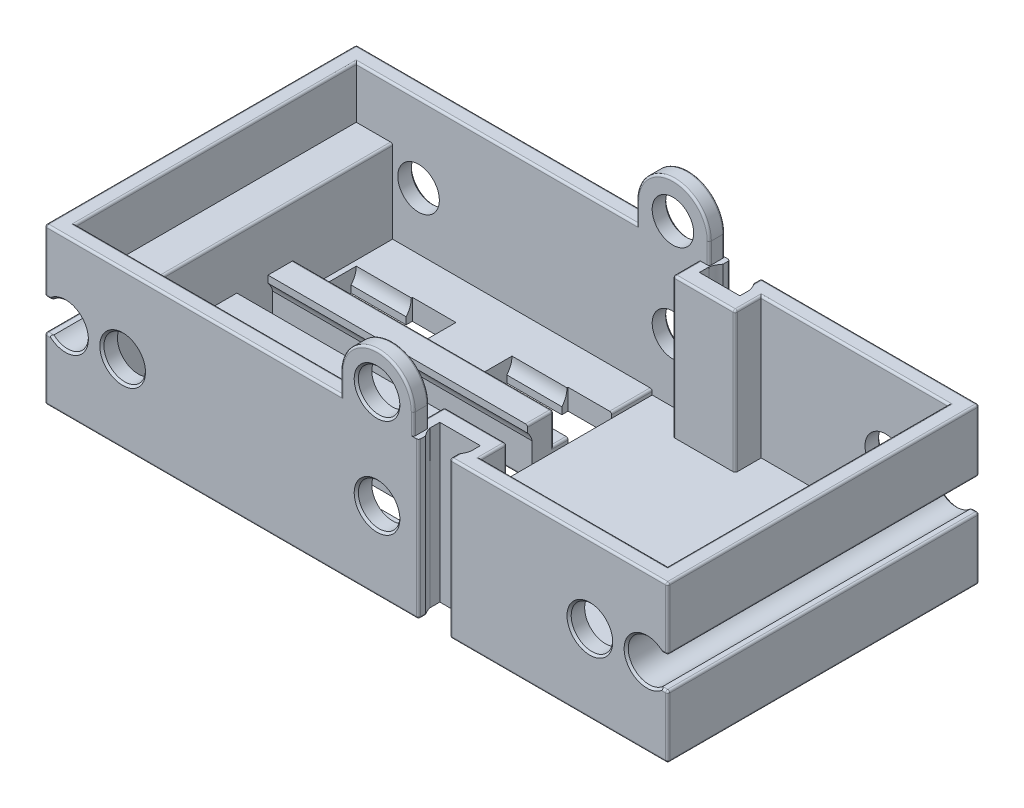
from build123d import *

# Parameters (mm, degrees)
SKETCH_1_W                  = 60
SKETCH_1_H                  = 30
EXTRUDE_1_DEPTH             = 15
CUT_EXTRUDE_1_DEPTH         = 5
CUT_EXTRUDE_2_DEPTH         = 8.5
CUT_EXTRUDE_3_REACH         = 38.742
SKETCH_5_R                  = 2
CUT_EXTRUDE_4_DEPTH         = 46
SKETCH_6_W                  = 2
SKETCH_6_H                  = 27
CUT_EXTRUDE_5_DEPTH         = 5
SKETCH_7_W                  = 2
SKETCH_7_H                  = 1.5
EXTRUDE_2_DEPTH             = 2.5
SKETCH_8_W                  = 25
SKETCH_8_H                  = 27
EXTRUDE_3_DEPTH             = 0.5
CUT_EXTRUDE_6_REACH         = 37.972
SKETCH_9_W                  = 4.2
SKETCH_9_H                  = 4.2
CUT_EXTRUDE_7_DEPTH         = 5.3
PATTERN_LINEAR_1_COUNT      = 2
PATTERN_LINEAR_1_PITCH      = 15
PATTERN_LINEAR_1_COUNT_DIR2 = 2
PATTERN_LINEAR_1_PITCH_DIR2 = 15
SKETCH_13_W                 = 8
SKETCH_13_H                 = 5
EXTRUDE_4_DEPTH             = 25
CUT_EXTRUDE_8_DEPTH         = 25
EXTRUDE_5_DEPTH             = 1.5
CUT_EXTRUDE_9_REACH         = 49.12
SKETCH_16_R                 = 2
FILLET_1_R                  = 0.2
FILLET_2_R                  = 0.2
FILLET_3_R                  = 0.2
CHAMFER_1_SIZE              = 0.2
FILLET_4_R                  = 0.2


with BuildPart() as part:
    # 草图1 → 凸台-拉伸1 (new body)
    with BuildSketch(Plane(origin=(0, 0, 0), x_dir=(1, 0, 0), z_dir=(0, 1, 0))):
        Rectangle(SKETCH_1_W, SKETCH_1_H)
    extrude(amount=EXTRUDE_1_DEPTH)

    # 草图2 → 切除-拉伸1 (cut)
    with BuildSketch(Plane(origin=(0, 15, 0), x_dir=(1, 0, 0), z_dir=(0, 1, 0))):
        Polygon((28.5, 13.5), (28.5, -13.5), (10.5, -13.5), (10.5, -11), (4.5, -11), (4.5, -13.5), (-28.5, -13.5), (-28.5, 13.5), (4.5, 13.5), (4.5, 11), (10.5, 11), (10.5, 13.5), align=None)
    extrude(amount=-CUT_EXTRUDE_1_DEPTH, mode=Mode.SUBTRACT)

    # 草图3 → 切除-拉伸2 (cut)
    with BuildSketch(Plane(origin=(0, 10, 0), x_dir=(1, 0, 0), z_dir=(0, 1, 0))):
        Polygon((-25, 13.5), (-25, -13.5), (4.5, -13.5), (4.5, -11), (10.5, -11), (10.5, -13.5), (25, -13.5), (25, 13.5), (10.5, 13.5), (10.5, 11), (4.5, 11), (4.5, 13.5), align=None)
    extrude(amount=-CUT_EXTRUDE_2_DEPTH, mode=Mode.SUBTRACT)

    # 草图4 → 切除-拉伸3 (cut, up to next)
    with BuildSketch(Plane(origin=(0, 15, 0), x_dir=(1, 0, 0), z_dir=(0, 1, 0)), mode=Mode.PRIVATE) as cut_extrude_3_sk1:
        with BuildLine():
            Line((9, -15), (6, -15))
            Line((6, -15), (6, -14.322875656))
            ThreePointArc((6, -14.322875656), (5.719957697, -13.911838473), (5.55, -13.444409721))
            Line((5.55, -13.444409721), (5.55, -12.5))
            Line((5.55, -12.5), (9.45, -12.5))
            Line((9.45, -12.5), (9.45, -13.444409721))
            ThreePointArc((9.45, -13.444409721), (9.280042303, -13.911838473), (9, -14.322875656))
            Line((9, -14.322875656), (9, -15))
        make_face()
    cut_extrude_3_tool1 = extrude(cut_extrude_3_sk1.sketch, amount=-CUT_EXTRUDE_3_REACH, mode=Mode.PRIVATE) & part.part
    cut_extrude_3 = cut_extrude_3_tool1.solids().sort_by_distance((7.5, 15, 13.675873))[0]
    add(cut_extrude_3, mode=Mode.SUBTRACT)

    # 镜向1: 切除-拉伸3 across plane
    add(cut_extrude_3.mirror(Plane.XY), mode=Mode.SUBTRACT)

    # 草图5 → 切除-拉伸4 (cut, through all)
    with BuildSketch(Plane.XY.offset(15)):
        with Locations((-22.5, 7.5)):
            Circle(SKETCH_5_R)
        with BuildLine():
            Line((-30, 6), (-30, 9))
            Line((-30, 9), (-29.322875656, 9))
            ThreePointArc((-29.322875656, 9), (-26, 7.5), (-29.322875656, 6))
            Line((-29.322875656, 6), (-30, 6))
        make_face()
    cut_extrude_4 = extrude(amount=-CUT_EXTRUDE_4_DEPTH, mode=Mode.SUBTRACT)

    # 镜向2: 切除-拉伸4 across plane
    add(cut_extrude_4.mirror(Plane(origin=(0, 0, 0), x_dir=(0, 0, 1), z_dir=(1, 0, 0))), mode=Mode.SUBTRACT)

    # 草图6 → 切除-拉伸5 (cut)
    with BuildSketch(Plane.XZ):
        with Locations((-27.5, 0)):
            Rectangle(SKETCH_6_W, SKETCH_6_H)
    cut_extrude_5 = extrude(amount=-CUT_EXTRUDE_5_DEPTH, mode=Mode.SUBTRACT)

    # 草图7 → 凸台-拉伸2 (add)
    with BuildSketch(Plane.XZ.offset(-5)):
        with Locations((-27.5, 2.75)):
            Rectangle(SKETCH_7_W, SKETCH_7_H)
        with Locations((-27.5, -2.75)):
            Rectangle(SKETCH_7_W, SKETCH_7_H)
    extrude_2 = extrude(amount=EXTRUDE_2_DEPTH)

    # 镜向3: 切除-拉伸5, 凸台-拉伸2 across plane
    add(cut_extrude_5.mirror(Plane(origin=(0, 0, 0), x_dir=(0, 0, 1), z_dir=(1, 0, 0))), mode=Mode.SUBTRACT)
    add(extrude_2.mirror(Plane(origin=(0, 0, 0), x_dir=(0, 0, 1), z_dir=(1, 0, 0))))

    # 草图8 → 凸台-拉伸3 (add)
    with BuildSketch(Plane(origin=(0, 1.5, 0), x_dir=(1, 0, 0), z_dir=(0, 1, 0))):
        with Locations((-12.5, 0)):
            Rectangle(SKETCH_8_W, SKETCH_8_H)
    extrude(amount=EXTRUDE_3_DEPTH)

    # 草图9 → 切除-拉伸6 (cut, up to next)
    with BuildSketch(Plane(origin=(0, 2, 0), x_dir=(1, 0, 0), z_dir=(0, 1, 0)), mode=Mode.PRIVATE) as cut_extrude_6_sk1:
        with Locations((-2.1, 7.5)):
            Rectangle(SKETCH_9_W, SKETCH_9_H)
    cut_extrude_6_tool1 = extrude(cut_extrude_6_sk1.sketch, amount=-CUT_EXTRUDE_6_REACH, mode=Mode.PRIVATE) & part.part
    cut_extrude_6 = cut_extrude_6_tool1.solids().sort_by_distance((-2.1, 2, -7.5))[0]
    add(cut_extrude_6, mode=Mode.SUBTRACT)

    # 草图10 → 切除-拉伸7 (cut)
    with BuildSketch(Plane(origin=(-4.2, 0, 0), x_dir=(0, 0, -1), z_dir=(1, 0, 0))):
        with BuildLine():
            Line((9, 0), (6, 0))
            Line((6, 0), (6, 0.677124344))
            ThreePointArc((6, 0.677124344), (7.5, 4), (9, 0.677124344))
            Line((9, 0.677124344), (9, 0))
        make_face()
    cut_extrude_7 = extrude(amount=-CUT_EXTRUDE_7_DEPTH, mode=Mode.SUBTRACT)

    # 阵列(线性)1: 切除-拉伸6, Cut-Extrude 7 2 × 2
    with Locations(*[(-i * PATTERN_LINEAR_1_PITCH, 0, j * PATTERN_LINEAR_1_PITCH_DIR2) for i in range(PATTERN_LINEAR_1_COUNT) for j in range(PATTERN_LINEAR_1_COUNT_DIR2) if (i, j) != (0, 0)]):
        add(cut_extrude_6, mode=Mode.SUBTRACT)
        add(cut_extrude_7, mode=Mode.SUBTRACT)

    # 草图13 → 凸台-拉伸4 (add)
    with BuildSketch(Plane(origin=(-25, 0, 0), x_dir=(0, 0, -1), z_dir=(1, 0, 0))):
        with Locations((0, 2.5)):
            Rectangle(SKETCH_13_W, SKETCH_13_H)
    extrude(amount=EXTRUDE_4_DEPTH)

    # 草图14 → 切除-拉伸8 (cut)
    with BuildSketch(Plane(origin=(0, 0, 0), x_dir=(0, 0, -1), z_dir=(1, 0, 0))):
        with BuildLine():
            Line((1.5, 5), (-1.5, 5))
            Line((-1.5, 5), (-1.5, 4.322875656))
            ThreePointArc((-1.5, 4.322875656), (-1.780042303, 3.911838473), (-1.95, 3.444409721))
            Line((-1.95, 3.444409721), (-1.95, 0))
            Line((-1.95, 0), (1.95, 0))
            Line((1.95, 0), (1.95, 3.444409721))
            ThreePointArc((1.95, 3.444409721), (1.780042303, 3.911838473), (1.5, 4.322875656))
            Line((1.5, 4.322875656), (1.5, 5))
        make_face()
    extrude(amount=-CUT_EXTRUDE_8_DEPTH, mode=Mode.SUBTRACT)

    # 草图15 → 凸台-拉伸5 (add)
    with BuildSketch(Plane(origin=(0, 0, -15), x_dir=(-1, 0, 0), z_dir=(0, 0, -1))):
        with BuildLine():
            Line((-5.5, 17), (-5.5, 15))
            Line((-5.5, 15), (1.5, 15))
            Line((1.5, 15), (1.5, 17))
            ThreePointArc((1.5, 17), (-2, 20.5), (-5.5, 17))
        make_face()
    extrude_5 = extrude(amount=-EXTRUDE_5_DEPTH)

    # 草图16 → 切除-拉伸9 (cut, up to next)
    with BuildSketch(Plane(origin=(0, 0, -15), x_dir=(-1, 0, 0), z_dir=(0, 0, -1)), mode=Mode.PRIVATE) as cut_extrude_9_sk1:
        with Locations((-2, 17)):
            Circle(SKETCH_16_R)
    cut_extrude_9_tool1 = extrude(cut_extrude_9_sk1.sketch, amount=-CUT_EXTRUDE_9_REACH, mode=Mode.PRIVATE) & part.part
    # 草图16 → 切除-拉伸9 (cut, up to next)
    with BuildSketch(Plane(origin=(0, 0, -15), x_dir=(-1, 0, 0), z_dir=(0, 0, -1)), mode=Mode.PRIVATE) as cut_extrude_9_sk2:
        with Locations((-2, 7.5)):
            Circle(SKETCH_16_R)
    cut_extrude_9_tool2 = extrude(cut_extrude_9_sk2.sketch, amount=-CUT_EXTRUDE_9_REACH, mode=Mode.PRIVATE) & part.part
    cut_extrude_9_1 = cut_extrude_9_tool1.solids().sort_by_distance((2, 17, -15))[0]
    add(cut_extrude_9_1, mode=Mode.SUBTRACT)
    cut_extrude_9_2 = cut_extrude_9_tool2.solids().sort_by_distance((2, 7.5, -15))[0]
    add(cut_extrude_9_2, mode=Mode.SUBTRACT)
    cut_extrude_9 = cut_extrude_9_1 + cut_extrude_9_2  # 切除-拉伸9 as one shape, for the pattern or mirror that repeats it

    # 镜向4: 凸台-拉伸5, 切除-拉伸9 across plane
    add(extrude_5.mirror(Plane.XY))
    add(cut_extrude_9.mirror(Plane.XY), mode=Mode.SUBTRACT)

    # 圆角1
    fillet_1_edges = [part.edges().sort_by_distance(p)[0] for p in [
        (-1.5, 16, -15),
        (-1.5, 16, -13.5),
        (5.5, 16, -15),
        (5.5, 16, -13.5),
        (-1.5, 16, 15),
        (-1.5, 16, 13.5),
        (5.5, 16, 15),
        (5.5, 16, 13.5),
        (-30, 0, 0),
        (-12, 0, 15),
        (-12, 0, -15),
        (19.5, 0, -15),
        (19.5, 0, 15),
        (30, 0, 0),
        (30, 3, -15),
        (30, 12, -15),
        (30, 3, 15),
        (30, 12, 15),
        (-30, 3, -15),
        (-30, 12, -15),
        (-30, 3, 15),
        (-30, 12, 15),
        (2, 20.5, -15),
        (2, 20.5, -13.5),
        (2, 20.5, 15),
        (2, 20.5, 13.5),
        (4.5, 15, 12.25),
        (7.5, 15, 11),
        (10.5, 15, 12.25),
        (19.5, 15, 13.5),
        (19.5, 15, 15),
        (28.5, 15, 0),
        (30, 15, 0),
        (19.5, 15, -15),
        (19.5, 15, -13.5),
        (10.5, 15, -12.25),
        (7.5, 15, -11),
        (4.5, 15, -12.25),
        (-15, 15, 13.5),
        (-15.75, 15, 15),
        (-28.5, 15, 0),
        (-15, 15, -13.5),
        (-15.75, 15, -15),
        (-30, 15, 0),
    ]]
    fillet(fillet_1_edges, radius=FILLET_1_R)

    # 圆角2
    # the kernel refuses this fillet: 0.2 mm, written as the material it takes off along each edge
    with BuildSketch(Plane(origin=(10.3, 14.8, 11.2), x_dir=(1, 0, 0), z_dir=(0, 0, -1))) as fillet_2_piece_1_section:
        Polygon((0, 0), (FILLET_2_R, 0), (FILLET_2_R, -FILLET_2_R), (0, -FILLET_2_R), align=None)
    fillet_2_piece_1 = extrude(amount=FILLET_2_R, mode=Mode.PRIVATE)
    fillet_2_piece_1 = fillet_2_piece_1 - Plane(origin=(10.3, 14.8, 11.2), x_dir=(-0.7071067811865475, -0.7071067811865475, 1.0048591735576168e-15), z_dir=(0, 0, -1)) * Sphere(FILLET_2_R, mode=Mode.PRIVATE)
    add(fillet_2_piece_1, mode=Mode.SUBTRACT)
    with BuildSketch(Plane(origin=(4.7, 14.8, 11.2), x_dir=(-1, 0, 0), z_dir=(0, 0, -1))) as fillet_2_piece_2_section:
        Polygon((0, 0), (FILLET_2_R, 0), (FILLET_2_R, FILLET_2_R), (0, FILLET_2_R), align=None)
    fillet_2_piece_2 = extrude(amount=FILLET_2_R, mode=Mode.PRIVATE)
    fillet_2_piece_2 = fillet_2_piece_2 - Plane(origin=(4.7, 14.8, 11.2), x_dir=(0.7071067811865475, -0.7071067811865475, 0), z_dir=(0, 0, -1)) * Sphere(FILLET_2_R, mode=Mode.PRIVATE)
    add(fillet_2_piece_2, mode=Mode.SUBTRACT)
    with BuildSketch(Plane(origin=(10.3, 14.8, -11.2), x_dir=(1, 0, 0), z_dir=(0, 0, 1))) as fillet_2_piece_3_section:
        Polygon((0, 0), (FILLET_2_R, 0), (FILLET_2_R, FILLET_2_R), (0, FILLET_2_R), align=None)
    fillet_2_piece_3 = extrude(amount=FILLET_2_R, mode=Mode.PRIVATE)
    fillet_2_piece_3 = fillet_2_piece_3 - Plane(origin=(10.3, 14.8, -11.2), x_dir=(-0.7071067811865475, -0.7071067811865475, -1.0048591735576152e-15), z_dir=(0, 0, 1)) * Sphere(FILLET_2_R, mode=Mode.PRIVATE)
    add(fillet_2_piece_3, mode=Mode.SUBTRACT)
    with BuildSketch(Plane(origin=(4.7, 14.8, -11.2), x_dir=(0, 0, 1), z_dir=(-1, 0, 0))) as fillet_2_piece_4_section:
        Polygon((0, 0), (FILLET_2_R, 0), (FILLET_2_R, FILLET_2_R), (0, FILLET_2_R), align=None)
    fillet_2_piece_4 = extrude(amount=FILLET_2_R, mode=Mode.PRIVATE)
    fillet_2_piece_4 = fillet_2_piece_4 - Plane(origin=(4.7, 14.8, -11.2), x_dir=(0, -0.7071067811865475, -0.7071067811865475), z_dir=(-1, 0, 0)) * Sphere(FILLET_2_R, mode=Mode.PRIVATE)
    add(fillet_2_piece_4, mode=Mode.SUBTRACT)
    with BuildSketch(Plane(origin=(0, 0, 1.95), x_dir=(0, 1, 0), z_dir=(0, 0, -1))) as fillet_2_piece_5:
        with BuildLine():
            CenterArc((FILLET_2_R, FILLET_2_R), FILLET_2_R, 180, 90)
            Line((0, FILLET_2_R), (0, 0))
            Line((0, 0), (FILLET_2_R, 0))
        make_face()
    extrude(amount=3.9, mode=Mode.SUBTRACT)
    with BuildSketch(Plane(origin=(0, 0, -1.95), x_dir=(0, 1, 0), z_dir=(-1, 0, 0))) as fillet_2_piece_6:
        with BuildLine():
            CenterArc((FILLET_2_R, FILLET_2_R), FILLET_2_R, 180, 90)
            Line((0, FILLET_2_R), (0, 0))
            Line((0, 0), (FILLET_2_R, 0))
        make_face()
    extrude(amount=25, mode=Mode.SUBTRACT)
    with BuildSketch(Plane(origin=(-25, 0, 1.95), x_dir=(0, 1, 0), z_dir=(0, 0, -1))) as fillet_2_piece_7:
        with BuildLine():
            CenterArc((FILLET_2_R, -FILLET_2_R), FILLET_2_R, 90, 90)
            Line((0, -FILLET_2_R), (0, 0))
            Line((0, 0), (FILLET_2_R, 0))
        make_face()
    extrude(amount=3.9, mode=Mode.SUBTRACT)
    with BuildSketch(Plane(origin=(0, 0, 1.95), x_dir=(0, 1, 0), z_dir=(-1, 0, 0))) as fillet_2_piece_8:
        with BuildLine():
            CenterArc((FILLET_2_R, -FILLET_2_R), FILLET_2_R, 90, 90)
            Line((0, -FILLET_2_R), (0, 0))
            Line((0, 0), (FILLET_2_R, 0))
        make_face()
    extrude(amount=25, mode=Mode.SUBTRACT)
    with BuildSketch(Plane(origin=(-26.5, 0, -13.5), x_dir=(0, 0, -1), z_dir=(-1, 0, 0)), Plane(origin=(-28.5, 0, 13.5), x_dir=(0, 0, 1), z_dir=(1, 0, 0))) as fillet_2_piece_9:
        with BuildLine():
            CenterArc((FILLET_2_R, -FILLET_2_R), FILLET_2_R, 90, 90)
            Line((0, -FILLET_2_R), (0, 0))
            Line((0, 0), (FILLET_2_R, 0))
        make_face()
    extrude(amount=2, mode=Mode.SUBTRACT)
    with BuildSketch(Plane(origin=(-28.5, 0, -13.5), x_dir=(-1, 0, 0), z_dir=(0, 0, 1)), Plane(origin=(-26.5, 0, 13.5), x_dir=(1, 0, 0), z_dir=(0, 0, -1)), Plane(origin=(25, 10, 13.5), x_dir=(0, -1, 0), z_dir=(0, 0, -1))) as fillet_2_piece_10:
        with BuildLine():
            CenterArc((FILLET_2_R, -FILLET_2_R), FILLET_2_R, 90, 90)
            Line((0, -FILLET_2_R), (0, 0))
            Line((0, 0), (FILLET_2_R, 0))
        make_face()
    extrude(amount=27, mode=Mode.SUBTRACT)
    with BuildSketch(Plane(origin=(26.5, 0, -13.5), x_dir=(0, 0, -1), z_dir=(1, 0, 0)), Plane(origin=(28.5, 0, 13.5), x_dir=(0, 0, 1), z_dir=(-1, 0, 0))) as fillet_2_piece_11:
        with BuildLine():
            CenterArc((FILLET_2_R, FILLET_2_R), FILLET_2_R, 180, 90)
            Line((0, FILLET_2_R), (0, 0))
            Line((0, 0), (FILLET_2_R, 0))
        make_face()
    extrude(amount=2, mode=Mode.SUBTRACT)
    with BuildSketch(Plane(origin=(26.5, 0, 13.5), x_dir=(-1, 0, 0), z_dir=(0, 0, -1)), Plane(origin=(28.5, 0, -13.5), x_dir=(1, 0, 0), z_dir=(0, 0, 1)), Plane(origin=(-25, 10, -13.5), x_dir=(-1, 0, 0), z_dir=(0, 0, 1))) as fillet_2_piece_12:
        with BuildLine():
            CenterArc((FILLET_2_R, FILLET_2_R), FILLET_2_R, 180, 90)
            Line((0, FILLET_2_R), (0, 0))
            Line((0, 0), (FILLET_2_R, 0))
        make_face()
    extrude(amount=27, mode=Mode.SUBTRACT)
    with BuildSketch(Plane(origin=(10.5, 1.5, 11), x_dir=(-1, 0, 0), z_dir=(0, 1, 0))) as fillet_2_piece_13:
        with BuildLine():
            CenterArc((FILLET_2_R, FILLET_2_R), FILLET_2_R, 180, 90)
            Line((0, FILLET_2_R), (0, 0))
            Line((0, 0), (FILLET_2_R, 0))
        make_face()
    extrude(amount=13.3, mode=Mode.SUBTRACT)
    with BuildSketch(Plane(origin=(4.5, 1.5, 11), x_dir=(1, 0, 0), z_dir=(0, 1, 0)), Plane(origin=(10.5, 1.5, -11), x_dir=(-1, 0, 0), z_dir=(0, 1, 0)), Plane(origin=(4.5, 1.5, -11), x_dir=(0, 0, -1), z_dir=(0, 1, 0))) as fillet_2_piece_14:
        with BuildLine():
            CenterArc((FILLET_2_R, -FILLET_2_R), FILLET_2_R, 90, 90)
            Line((0, -FILLET_2_R), (0, 0))
            Line((0, 0), (FILLET_2_R, 0))
        make_face()
    extrude(amount=13.3, mode=Mode.SUBTRACT)
    with BuildSketch(Plane(origin=(0.5, 0, 1.95), x_dir=(0, 1, 0), z_dir=(-1, 0, 0))) as fillet_2_piece_15a_section:
        with BuildLine():
            CenterArc((FILLET_2_R, -FILLET_2_R), FILLET_2_R, 90, 90)
            Line((0, -FILLET_2_R), (0, 0))
            Line((0, 0), (FILLET_2_R, 0))
        make_face()
    fillet_2_piece_15a = extrude(amount=25.5, mode=Mode.PRIVATE)
    fillet_2_piece_15a = split(fillet_2_piece_15a, bisect_by=Plane(origin=(0, 0.045279023, 1.995279023), z_dir=(1, 0, 0)), keep=Keep.TOP, mode=Mode.PRIVATE)
    with BuildSketch(Plane(origin=(0, 0, 2.45), x_dir=(0, 1, 0), z_dir=(0, 0, -1))) as fillet_2_piece_15b_section:
        with BuildLine():
            CenterArc((FILLET_2_R, FILLET_2_R), FILLET_2_R, 180, 90)
            Line((0, FILLET_2_R), (0, 0))
            Line((0, 0), (FILLET_2_R, 0))
        make_face()
    fillet_2_piece_15b = extrude(amount=4.4, mode=Mode.PRIVATE)
    fillet_2_piece_15b = split(fillet_2_piece_15b, bisect_by=Plane(origin=(0.045279023, 0.045279023, 1.95), z_dir=(0, 0, 1)), keep=Keep.TOP, mode=Mode.PRIVATE)
    fillet_2_piece_15 = fillet_2_piece_15a & fillet_2_piece_15b
    add(fillet_2_piece_15, mode=Mode.SUBTRACT)
    with BuildSketch(Plane(origin=(0.5, 0, -1.95), x_dir=(0, 1, 0), z_dir=(-1, 0, 0))) as fillet_2_piece_16a_section:
        with BuildLine():
            CenterArc((FILLET_2_R, FILLET_2_R), FILLET_2_R, 180, 90)
            Line((0, FILLET_2_R), (0, 0))
            Line((0, 0), (FILLET_2_R, 0))
        make_face()
    fillet_2_piece_16a = extrude(amount=25.5, mode=Mode.PRIVATE)
    fillet_2_piece_16a = split(fillet_2_piece_16a, bisect_by=Plane(origin=(0, 0.045279023, -1.995279023), z_dir=(1, 0, 0)), keep=Keep.TOP, mode=Mode.PRIVATE)
    with BuildSketch(Plane(origin=(0, 0, 1.95), x_dir=(0, 1, 0), z_dir=(0, 0, -1))) as fillet_2_piece_16b_section:
        with BuildLine():
            CenterArc((FILLET_2_R, FILLET_2_R), FILLET_2_R, 180, 90)
            Line((0, FILLET_2_R), (0, 0))
            Line((0, 0), (FILLET_2_R, 0))
        make_face()
    fillet_2_piece_16b = extrude(amount=4.4, mode=Mode.PRIVATE)
    fillet_2_piece_16b = split(fillet_2_piece_16b, bisect_by=Plane(origin=(0.045279023, 0.045279023, -1.95), z_dir=(0, 0, -1)), keep=Keep.TOP, mode=Mode.PRIVATE)
    fillet_2_piece_16 = fillet_2_piece_16a & fillet_2_piece_16b
    add(fillet_2_piece_16, mode=Mode.SUBTRACT)
    with BuildSketch(Plane(origin=(-25, 0, 1.95), x_dir=(0, 1, 0), z_dir=(0, 0, -1))) as fillet_2_piece_17a_section:
        with BuildLine():
            CenterArc((FILLET_2_R, -FILLET_2_R), FILLET_2_R, 90, 90)
            Line((0, -FILLET_2_R), (0, 0))
            Line((0, 0), (FILLET_2_R, 0))
        make_face()
    fillet_2_piece_17a = extrude(amount=4.4, mode=Mode.PRIVATE)
    fillet_2_piece_17a = split(fillet_2_piece_17a, bisect_by=Plane(origin=(-25.045279023, 0.045279023, -1.95), z_dir=(0, 0, -1)), keep=Keep.TOP, mode=Mode.PRIVATE)
    with BuildSketch(Plane(origin=(0, 0, -1.95), x_dir=(0, 1, 0), z_dir=(-1, 0, 0))) as fillet_2_piece_17b_section:
        with BuildLine():
            CenterArc((FILLET_2_R, FILLET_2_R), FILLET_2_R, 180, 90)
            Line((0, FILLET_2_R), (0, 0))
            Line((0, 0), (FILLET_2_R, 0))
        make_face()
    fillet_2_piece_17b = extrude(amount=25.5, mode=Mode.PRIVATE)
    fillet_2_piece_17b = split(fillet_2_piece_17b, bisect_by=Plane(origin=(-25, 0.045279023, -1.995279023), z_dir=(-1, 0, 0)), keep=Keep.TOP, mode=Mode.PRIVATE)
    fillet_2_piece_17 = fillet_2_piece_17a & fillet_2_piece_17b
    add(fillet_2_piece_17, mode=Mode.SUBTRACT)
    with BuildSketch(Plane(origin=(-25, 0, 2.45), x_dir=(0, 1, 0), z_dir=(0, 0, -1))) as fillet_2_piece_18a_section:
        with BuildLine():
            CenterArc((FILLET_2_R, -FILLET_2_R), FILLET_2_R, 90, 90)
            Line((0, -FILLET_2_R), (0, 0))
            Line((0, 0), (FILLET_2_R, 0))
        make_face()
    fillet_2_piece_18a = extrude(amount=4.4, mode=Mode.PRIVATE)
    fillet_2_piece_18a = split(fillet_2_piece_18a, bisect_by=Plane(origin=(-25.045279023, 0.045279023, 1.95), z_dir=(0, 0, 1)), keep=Keep.TOP, mode=Mode.PRIVATE)
    with BuildSketch(Plane(origin=(0, 0, 1.95), x_dir=(0, 1, 0), z_dir=(-1, 0, 0))) as fillet_2_piece_18b_section:
        with BuildLine():
            CenterArc((FILLET_2_R, -FILLET_2_R), FILLET_2_R, 90, 90)
            Line((0, -FILLET_2_R), (0, 0))
            Line((0, 0), (FILLET_2_R, 0))
        make_face()
    fillet_2_piece_18b = extrude(amount=25.5, mode=Mode.PRIVATE)
    fillet_2_piece_18b = split(fillet_2_piece_18b, bisect_by=Plane(origin=(-25, 0.045279023, 1.995279023), z_dir=(-1, 0, 0)), keep=Keep.TOP, mode=Mode.PRIVATE)
    fillet_2_piece_18 = fillet_2_piece_18a & fillet_2_piece_18b
    add(fillet_2_piece_18, mode=Mode.SUBTRACT)
    with BuildSketch(Plane(origin=(-26, 0, -13.5), x_dir=(0, 0, -1), z_dir=(-1, 0, 0))) as fillet_2_piece_19a_section:
        with BuildLine():
            CenterArc((FILLET_2_R, -FILLET_2_R), FILLET_2_R, 90, 90)
            Line((0, -FILLET_2_R), (0, 0))
            Line((0, 0), (FILLET_2_R, 0))
        make_face()
    fillet_2_piece_19a = extrude(amount=2.5, mode=Mode.PRIVATE)
    fillet_2_piece_19a = split(fillet_2_piece_19a, bisect_by=Plane(origin=(-26.5, 0.045279023, -13.545279023), z_dir=(1, 0, 0)), keep=Keep.TOP, mode=Mode.PRIVATE)
    with BuildSketch(Plane(origin=(-26.5, 0, 13.5), x_dir=(1, 0, 0), z_dir=(0, 0, -1))) as fillet_2_piece_19b_section:
        with BuildLine():
            CenterArc((FILLET_2_R, -FILLET_2_R), FILLET_2_R, 90, 90)
            Line((0, -FILLET_2_R), (0, 0))
            Line((0, 0), (FILLET_2_R, 0))
        make_face()
    fillet_2_piece_19b = extrude(amount=27.5, mode=Mode.PRIVATE)
    fillet_2_piece_19b = split(fillet_2_piece_19b, bisect_by=Plane(origin=(-26.454720977, 0.045279023, -13.5), z_dir=(0, 0, -1)), keep=Keep.TOP, mode=Mode.PRIVATE)
    fillet_2_piece_19 = fillet_2_piece_19a & fillet_2_piece_19b
    add(fillet_2_piece_19, mode=Mode.SUBTRACT)
    with BuildSketch(Plane(origin=(-28.5, 0, -14), x_dir=(-1, 0, 0), z_dir=(0, 0, 1))) as fillet_2_piece_20a_section:
        with BuildLine():
            CenterArc((FILLET_2_R, -FILLET_2_R), FILLET_2_R, 90, 90)
            Line((0, -FILLET_2_R), (0, 0))
            Line((0, 0), (FILLET_2_R, 0))
        make_face()
    fillet_2_piece_20a = extrude(amount=27.5, mode=Mode.PRIVATE)
    fillet_2_piece_20a = split(fillet_2_piece_20a, bisect_by=Plane(origin=(-28.545279023, 0.045279023, -13.5), z_dir=(0, 0, -1)), keep=Keep.TOP, mode=Mode.PRIVATE)
    with BuildSketch(Plane(origin=(-26.5, 0, -13.5), x_dir=(0, 0, -1), z_dir=(-1, 0, 0))) as fillet_2_piece_20b_section:
        with BuildLine():
            CenterArc((FILLET_2_R, -FILLET_2_R), FILLET_2_R, 90, 90)
            Line((0, -FILLET_2_R), (0, 0))
            Line((0, 0), (FILLET_2_R, 0))
        make_face()
    fillet_2_piece_20b = extrude(amount=2.5, mode=Mode.PRIVATE)
    fillet_2_piece_20b = split(fillet_2_piece_20b, bisect_by=Plane(origin=(-28.5, 0.045279023, -13.545279023), z_dir=(-1, 0, 0)), keep=Keep.TOP, mode=Mode.PRIVATE)
    fillet_2_piece_20 = fillet_2_piece_20a & fillet_2_piece_20b
    add(fillet_2_piece_20, mode=Mode.SUBTRACT)
    with BuildSketch(Plane(origin=(-28.5, 0, -13.5), x_dir=(-1, 0, 0), z_dir=(0, 0, 1))) as fillet_2_piece_21a_section:
        with BuildLine():
            CenterArc((FILLET_2_R, -FILLET_2_R), FILLET_2_R, 90, 90)
            Line((0, -FILLET_2_R), (0, 0))
            Line((0, 0), (FILLET_2_R, 0))
        make_face()
    fillet_2_piece_21a = extrude(amount=27.5, mode=Mode.PRIVATE)
    fillet_2_piece_21a = split(fillet_2_piece_21a, bisect_by=Plane(origin=(-28.545279023, 0.045279023, 13.5), z_dir=(0, 0, 1)), keep=Keep.TOP, mode=Mode.PRIVATE)
    with BuildSketch(Plane(origin=(-29, 0, 13.5), x_dir=(0, 0, 1), z_dir=(1, 0, 0))) as fillet_2_piece_21b_section:
        with BuildLine():
            CenterArc((FILLET_2_R, -FILLET_2_R), FILLET_2_R, 90, 90)
            Line((0, -FILLET_2_R), (0, 0))
            Line((0, 0), (FILLET_2_R, 0))
        make_face()
    fillet_2_piece_21b = extrude(amount=2.5, mode=Mode.PRIVATE)
    fillet_2_piece_21b = split(fillet_2_piece_21b, bisect_by=Plane(origin=(-28.5, 0.045279023, 13.545279023), z_dir=(-1, 0, 0)), keep=Keep.TOP, mode=Mode.PRIVATE)
    fillet_2_piece_21 = fillet_2_piece_21a & fillet_2_piece_21b
    add(fillet_2_piece_21, mode=Mode.SUBTRACT)
    with BuildSketch(Plane(origin=(-28.5, 0, 13.5), x_dir=(0, 0, 1), z_dir=(1, 0, 0))) as fillet_2_piece_22a_section:
        with BuildLine():
            CenterArc((FILLET_2_R, -FILLET_2_R), FILLET_2_R, 90, 90)
            Line((0, -FILLET_2_R), (0, 0))
            Line((0, 0), (FILLET_2_R, 0))
        make_face()
    fillet_2_piece_22a = extrude(amount=2.5, mode=Mode.PRIVATE)
    fillet_2_piece_22a = split(fillet_2_piece_22a, bisect_by=Plane(origin=(-26.5, 0.045279023, 13.545279023), z_dir=(1, 0, 0)), keep=Keep.TOP, mode=Mode.PRIVATE)
    with BuildSketch(Plane(origin=(-26.5, 0, 14), x_dir=(1, 0, 0), z_dir=(0, 0, -1))) as fillet_2_piece_22b_section:
        with BuildLine():
            CenterArc((FILLET_2_R, -FILLET_2_R), FILLET_2_R, 90, 90)
            Line((0, -FILLET_2_R), (0, 0))
            Line((0, 0), (FILLET_2_R, 0))
        make_face()
    fillet_2_piece_22b = extrude(amount=27.5, mode=Mode.PRIVATE)
    fillet_2_piece_22b = split(fillet_2_piece_22b, bisect_by=Plane(origin=(-26.454720977, 0.045279023, 13.5), z_dir=(0, 0, 1)), keep=Keep.TOP, mode=Mode.PRIVATE)
    fillet_2_piece_22 = fillet_2_piece_22a & fillet_2_piece_22b
    add(fillet_2_piece_22, mode=Mode.SUBTRACT)
    with BuildSketch(Plane(origin=(26.5, 0, 13.5), x_dir=(-1, 0, 0), z_dir=(0, 0, -1))) as fillet_2_piece_23a_section:
        with BuildLine():
            CenterArc((FILLET_2_R, FILLET_2_R), FILLET_2_R, 180, 90)
            Line((0, FILLET_2_R), (0, 0))
            Line((0, 0), (FILLET_2_R, 0))
        make_face()
    fillet_2_piece_23a = extrude(amount=27.5, mode=Mode.PRIVATE)
    fillet_2_piece_23a = split(fillet_2_piece_23a, bisect_by=Plane(origin=(26.454720977, 0.045279023, -13.5), z_dir=(0, 0, -1)), keep=Keep.TOP, mode=Mode.PRIVATE)
    with BuildSketch(Plane(origin=(26, 0, -13.5), x_dir=(0, 0, -1), z_dir=(1, 0, 0))) as fillet_2_piece_23b_section:
        with BuildLine():
            CenterArc((FILLET_2_R, FILLET_2_R), FILLET_2_R, 180, 90)
            Line((0, FILLET_2_R), (0, 0))
            Line((0, 0), (FILLET_2_R, 0))
        make_face()
    fillet_2_piece_23b = extrude(amount=2.5, mode=Mode.PRIVATE)
    fillet_2_piece_23b = split(fillet_2_piece_23b, bisect_by=Plane(origin=(26.5, 0.045279023, -13.545279023), z_dir=(-1, 0, 0)), keep=Keep.TOP, mode=Mode.PRIVATE)
    fillet_2_piece_23 = fillet_2_piece_23a & fillet_2_piece_23b
    add(fillet_2_piece_23, mode=Mode.SUBTRACT)
    with BuildSketch(Plane(origin=(28.5, 0, -14), x_dir=(1, 0, 0), z_dir=(0, 0, 1))) as fillet_2_piece_24a_section:
        with BuildLine():
            CenterArc((FILLET_2_R, FILLET_2_R), FILLET_2_R, 180, 90)
            Line((0, FILLET_2_R), (0, 0))
            Line((0, 0), (FILLET_2_R, 0))
        make_face()
    fillet_2_piece_24a = extrude(amount=27.5, mode=Mode.PRIVATE)
    fillet_2_piece_24a = split(fillet_2_piece_24a, bisect_by=Plane(origin=(28.545279023, 0.045279023, -13.5), z_dir=(0, 0, -1)), keep=Keep.TOP, mode=Mode.PRIVATE)
    with BuildSketch(Plane(origin=(26.5, 0, -13.5), x_dir=(0, 0, -1), z_dir=(1, 0, 0))) as fillet_2_piece_24b_section:
        with BuildLine():
            CenterArc((FILLET_2_R, FILLET_2_R), FILLET_2_R, 180, 90)
            Line((0, FILLET_2_R), (0, 0))
            Line((0, 0), (FILLET_2_R, 0))
        make_face()
    fillet_2_piece_24b = extrude(amount=2.5, mode=Mode.PRIVATE)
    fillet_2_piece_24b = split(fillet_2_piece_24b, bisect_by=Plane(origin=(28.5, 0.045279023, -13.545279023), z_dir=(1, 0, 0)), keep=Keep.TOP, mode=Mode.PRIVATE)
    fillet_2_piece_24 = fillet_2_piece_24a & fillet_2_piece_24b
    add(fillet_2_piece_24, mode=Mode.SUBTRACT)
    with BuildSketch(Plane(origin=(28.5, 0, 13.5), x_dir=(0, 0, 1), z_dir=(-1, 0, 0))) as fillet_2_piece_25a_section:
        with BuildLine():
            CenterArc((FILLET_2_R, FILLET_2_R), FILLET_2_R, 180, 90)
            Line((0, FILLET_2_R), (0, 0))
            Line((0, 0), (FILLET_2_R, 0))
        make_face()
    fillet_2_piece_25a = extrude(amount=2.5, mode=Mode.PRIVATE)
    fillet_2_piece_25a = split(fillet_2_piece_25a, bisect_by=Plane(origin=(26.5, 0.045279023, 13.545279023), z_dir=(-1, 0, 0)), keep=Keep.TOP, mode=Mode.PRIVATE)
    with BuildSketch(Plane(origin=(26.5, 0, 14), x_dir=(-1, 0, 0), z_dir=(0, 0, -1))) as fillet_2_piece_25b_section:
        with BuildLine():
            CenterArc((FILLET_2_R, FILLET_2_R), FILLET_2_R, 180, 90)
            Line((0, FILLET_2_R), (0, 0))
            Line((0, 0), (FILLET_2_R, 0))
        make_face()
    fillet_2_piece_25b = extrude(amount=27.5, mode=Mode.PRIVATE)
    fillet_2_piece_25b = split(fillet_2_piece_25b, bisect_by=Plane(origin=(26.454720977, 0.045279023, 13.5), z_dir=(0, 0, 1)), keep=Keep.TOP, mode=Mode.PRIVATE)
    fillet_2_piece_25 = fillet_2_piece_25a & fillet_2_piece_25b
    add(fillet_2_piece_25, mode=Mode.SUBTRACT)
    with BuildSketch(Plane(origin=(29, 0, 13.5), x_dir=(0, 0, 1), z_dir=(-1, 0, 0))) as fillet_2_piece_26a_section:
        with BuildLine():
            CenterArc((FILLET_2_R, FILLET_2_R), FILLET_2_R, 180, 90)
            Line((0, FILLET_2_R), (0, 0))
            Line((0, 0), (FILLET_2_R, 0))
        make_face()
    fillet_2_piece_26a = extrude(amount=2.5, mode=Mode.PRIVATE)
    fillet_2_piece_26a = split(fillet_2_piece_26a, bisect_by=Plane(origin=(28.5, 0.045279023, 13.545279023), z_dir=(1, 0, 0)), keep=Keep.TOP, mode=Mode.PRIVATE)
    with BuildSketch(Plane(origin=(28.5, 0, -13.5), x_dir=(1, 0, 0), z_dir=(0, 0, 1))) as fillet_2_piece_26b_section:
        with BuildLine():
            CenterArc((FILLET_2_R, FILLET_2_R), FILLET_2_R, 180, 90)
            Line((0, FILLET_2_R), (0, 0))
            Line((0, 0), (FILLET_2_R, 0))
        make_face()
    fillet_2_piece_26b = extrude(amount=27.5, mode=Mode.PRIVATE)
    fillet_2_piece_26b = split(fillet_2_piece_26b, bisect_by=Plane(origin=(28.545279023, 0.045279023, 13.5), z_dir=(0, 0, 1)), keep=Keep.TOP, mode=Mode.PRIVATE)
    fillet_2_piece_26 = fillet_2_piece_26a & fillet_2_piece_26b
    add(fillet_2_piece_26, mode=Mode.SUBTRACT)

    # 圆角3
    fillet_3_edges = [part.edges().sort_by_distance(p)[0] for p in [
        (0, 2, 11.55),
        (0, 2, -11.55),
        (0, 2, 4.7),
        (0, 2, -4.7),
        (-12.5, 5, -4),
        (-12.5, 5, 4),
        (0, 3.5, 4),
        (0, 3.5, -4),
        (0, 5, -2.75),
        (0, 5, 2.75),
    ]]
    fillet(fillet_3_edges, radius=FILLET_3_R)

    # 倒角1
    chamfer_1_edges = [part.edges().sort_by_distance(p)[0] for p in [
        (-24.5, 7.5, -15),
        (-24.5, 7.5, 15),
        (-26, 7.5, -15),
        (-26, 7.5, 15),
        (24.5, 7.5, 15),
        (24.5, 7.5, -15),
        (26, 7.5, 15),
        (26, 7.5, -15),
        (4, 17, -15),
        (4, 7.5, -15),
        (4, 17, 15),
        (4, 7.5, 15),
    ]]
    chamfer(chamfer_1_edges, length=CHAMFER_1_SIZE)

    # 圆角4
    fillet_4_edges = [part.edges().sort_by_distance(p)[0] for p in [
        (9, 0, -14.561437828),
        (9, 0.058578644, -14.941421356),
        (9, 15, -14.561437828),
        (9, 14.941421356, -14.941421356),
        (6, 0, -14.561437828),
        (6, 0.058578644, -14.941421356),
        (6, 0, 14.561437828),
        (6, 0.058578644, 14.941421356),
        (9, 0, 14.561437828),
        (9, 0.058578644, 14.941421356),
        (9, 15, 14.561437828),
        (9, 14.941421356, 14.941421356),
        (29.704673847, 9, -15),
        (29.941421356, 9, -14.941421356),
        (29.704673847, 9, 15),
        (29.941421356, 9, 14.941421356),
        (29.704673847, 6, -15),
        (29.941421356, 6, -14.941421356),
        (29.704673847, 6, 15),
        (29.941421356, 6, 14.941421356),
        (-29.704673847, 9, -15),
        (-29.941421356, 9, -14.941421356),
        (-29.704673847, 9, 15),
        (-29.941421356, 9, 14.941421356),
        (-29.704673847, 6, -15),
        (-29.941421356, 6, -14.941421356),
        (-29.704673847, 6, 15),
        (-29.941421356, 6, 14.941421356),
        (9, 7.5, -15),
        (6, 7.6, -15),
        (6, 7.6, 15),
        (9, 7.5, 15),
        (30, 9, 0),
        (30, 6, 0),
        (-30, 9, 0),
        (-30, 6, 0),
    ]]
    fillet(fillet_4_edges, radius=FILLET_4_R)


solid = part.part
